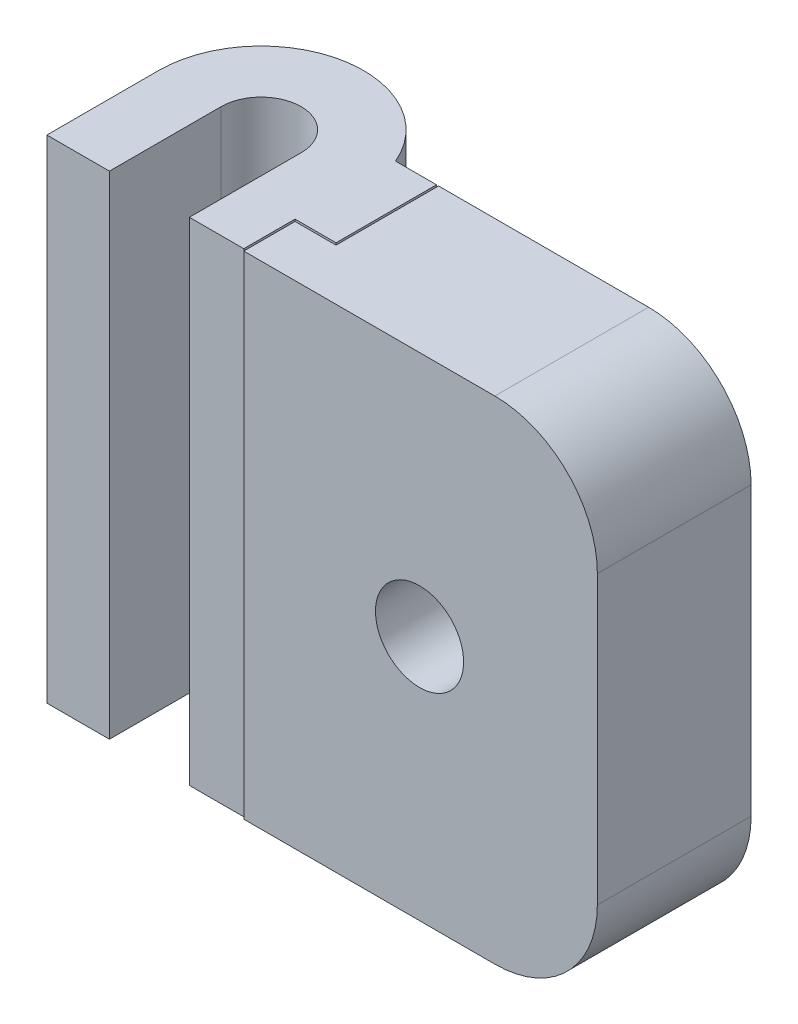
from build123d import *

# Parameters (mm, degrees)
BOSS_EXTRUDE3_DEPTH = 24
FILLET1_R           = 5
SKETCH10_R          = 4.1
CUT_EXTRUDE3_DEPTH  = 3
SKETCH11_R          = 2.15
CUT_EXTRUDE4_DEPTH  = 34.081792575
CUT_EXTRUDE5_DEPTH  = 33.994014609
SKETCH14_W          = 3.05
SKETCH14_H          = 24
SKETCH14_W_2        = 2.654074283
CUT_EXTRUDE6_DEPTH  = 0.1


with BuildPart() as part:
    # Sketch4 → Boss-Extrude3 (new body)
    with BuildSketch(Plane(origin=(0, 0, 0), x_dir=(1, 0, 0), z_dir=(0, 1, 0))):
        with BuildLine():
            Line((21.95, 0), (21.95, 1.95))
            Line((21.95, 1.95), (4.604074283, 1.95))
            ThreePointArc((4.604074283, 1.95), (-0.994894112, 4.90001895), (-5, 0))
            Line((-5, 0), (-5, -5.55))
            Line((-5, -5.55), (-1.95, -5.55))
            Line((-1.95, -5.55), (-1.95, 0))
            ThreePointArc((-1.95, 0), (0, 1.95), (1.95, 0))
            Line((1.95, 0), (1.95, -5.55))
            Line((1.95, -5.55), (21.95, -5.55))
            Line((21.95, -5.55), (21.95, 0))
        make_face()
    extrude(amount=BOSS_EXTRUDE3_DEPTH)

    # Fillet1
    fillet1_edges = [part.edges().sort_by_distance(p)[0] for p in [
        (21.95, 0, 1.8),
        (21.95, 24, 1.8),
    ]]
    fillet(fillet1_edges, radius=FILLET1_R)

    # Sketch10 → Cut-Extrude3 (cut)
    with BuildSketch(Plane(origin=(0, 0, -1.95), x_dir=(-1, 0, 0), z_dir=(0, 0, -1))):
        with Locations((-13.277037141, 12)):
            Circle(SKETCH10_R)
    extrude(amount=-CUT_EXTRUDE3_DEPTH, mode=Mode.SUBTRACT)

    # Sketch11 → Cut-Extrude4 (cut, through all)
    with BuildSketch(Plane(origin=(0, 0, 1.05), x_dir=(-1, 0, 0), z_dir=(0, 0, -1))):
        with Locations((-13.277037141, 12)):
            Circle(SKETCH11_R)
    extrude(amount=-CUT_EXTRUDE4_DEPTH, mode=Mode.SUBTRACT)

    # Sketch13 → Cut-Extrude5 (cut, through all)
    with BuildSketch(Plane.XZ):
        Polygon((6.604074283, -1.95), (6.604074283, 2.95), (4.604074283, 2.95), (4.604074283, 5.55), (4.704074283, 5.55), (4.704074283, 3.05), (6.704074283, 3.05), (6.704074283, -1.95), align=None)
    extrude(amount=-CUT_EXTRUDE5_DEPTH, mode=Mode.SUBTRACT)


with BuildPart() as cut_extrude5_piece_1:
    # of the separate pieces the step leaves, piece 1, a body of its own (cut_extrude5_pieces)
    add(part.part.solids().sort_by_distance((21.95, 5, -1.95))[0])


with BuildPart() as cut_extrude5_piece_2:
    # of the separate pieces the step leaves, piece 2, a body of its own (cut_extrude5_pieces)
    add(part.part.solids().sort_by_distance((6.604074283, 0, -1.95))[0])

    # Sketch14 → Cut-Extrude6 (cut)
    with BuildSketch(Plane.XY.offset(5.55)):
        with Locations((-3.475, 12)):
            Rectangle(SKETCH14_W, SKETCH14_H)
        with Locations((3.277037142, 12)):
            Rectangle(SKETCH14_W_2, SKETCH14_H)
    extrude(amount=-CUT_EXTRUDE6_DEPTH, mode=Mode.SUBTRACT)


solid = Compound([cut_extrude5_piece_1.part, cut_extrude5_piece_2.part])
